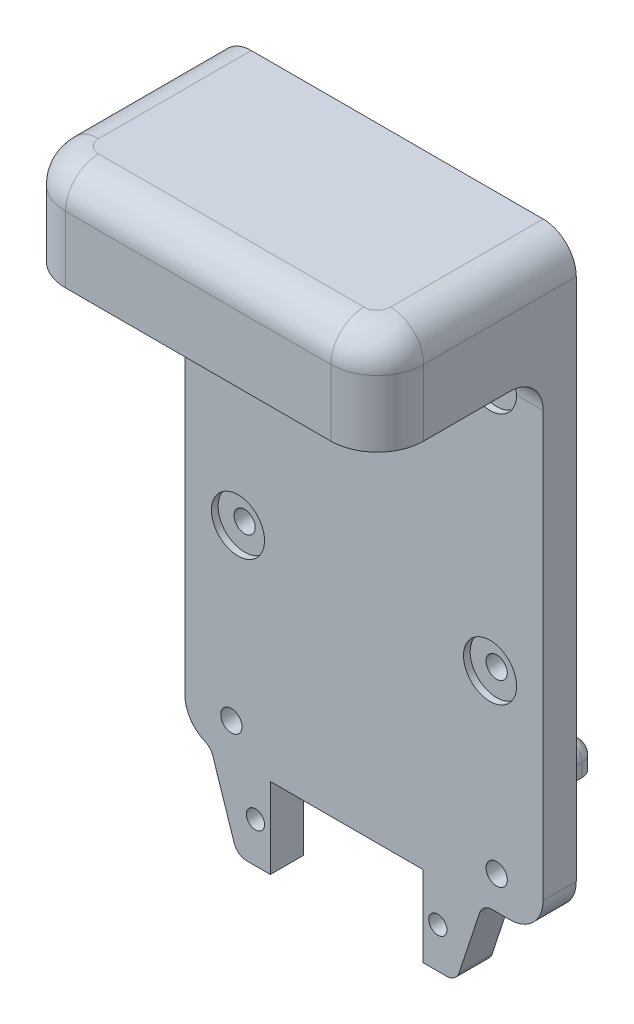
from build123d import *

# Parameters (mm, degrees)
SKETCH_1_R               = 1.6
SKETCH_1_R_2             = 1.375
EXTRUDE_1_DEPTH          = 5
SKETCH_2_W               = 54
SKETCH_2_H               = 15
EXTRUDE_2_DEPTH          = 25
SKETCH_3_R               = 3
CUT_EXTRUDE_1_DEPTH      = 10
FILLET_1_R               = 7
FILLET_2_R               = 5
FILLET_3_R               = 5
CHAMFER_1_SIZE           = 0.5
CUT_EXTRUDE_2_DEPTH      = 73.226189886
CUT_EXTRUDE_2_DEPTH_BACK = 1
SKETCH_4_R               = 4
FILLET_4_R               = 5
SKETCH_5_W               = 23
SKETCH_5_H               = 4
EXTRUDE_3_DEPTH          = 21
FILLET_5_R               = 2
FILLET_6_R               = 3
CUT_EXTRUDE_3_DEPTH      = 1
CUT_EXTRUDE_3_DEPTH_BACK = 75.10548229
SKETCH_6_R               = 3.25


with BuildPart() as part:
    # 草图1 → 凸台-拉伸1 (new body)
    with BuildSketch(Plane.XY):
        Polygon((-27, -50), (-23.12, -50), (-19.12, -62.15), (-14.12, -62.15), (-14.12, -50), (8.88, -50), (8.88, -62.15), (13.88, -62.15), (17.88, -50), (27, -50), (27, 39), (-27, 39), align=None)
        with Locations((-19, 19)):
            Circle(SKETCH_1_R, mode=Mode.SUBTRACT)
        with Locations((19, 19)):
            Circle(SKETCH_1_R, mode=Mode.SUBTRACT)
        with Locations((19, -19)):
            Circle(SKETCH_1_R, mode=Mode.SUBTRACT)
        with Locations((-19, -19)):
            Circle(SKETCH_1_R, mode=Mode.SUBTRACT)
        with Locations((-20, -45)):
            Circle(SKETCH_1_R, mode=Mode.SUBTRACT)
        with Locations(Location((20, -45, 0), (0, 0, 180))):
            Circle(SKETCH_1_R, mode=Mode.SUBTRACT)
        with Locations((-16.37, -56.075)):
            Circle(SKETCH_1_R_2, mode=Mode.SUBTRACT)
        with Locations(Location((11.13, -56.075, 0), (0, 0, 180))):
            Circle(SKETCH_1_R_2, mode=Mode.SUBTRACT)
    extrude(amount=EXTRUDE_1_DEPTH)

    # 草图2 → 凸台-拉伸2 (add)
    with BuildSketch(Plane.XY.offset(5)):
        with Locations((0, 31.5)):
            Rectangle(SKETCH_2_W, SKETCH_2_H)
    extrude(amount=EXTRUDE_2_DEPTH)

    # 草图3 → 切除-拉伸1 (cut)
    with BuildSketch(Plane.XZ.offset(-24)):
        with Locations(Location((-20, 23, 0), (0, 0, 270))):
            Circle(SKETCH_3_R)
        with Locations(Location((20, 23, 0), (0, 0, 90))):
            Circle(SKETCH_3_R)
    extrude(amount=-CUT_EXTRUDE_1_DEPTH, mode=Mode.SUBTRACT)

    # 圆角1
    fillet_1_edges = [part.edges().sort_by_distance(p)[0] for p in [
        (-27, 31.5, 30),
        (27, 31.5, 30),
    ]]
    fillet(fillet_1_edges, radius=FILLET_1_R)

    # 圆角2
    fillet_2_edges = [part.edges().sort_by_distance(p)[0] for p in [
        (0, 39, 30),
        (-27, 39, 11.5),
        (27, 39, 11.5),
        (-24.949747468, 39, 27.949747468),
        (24.949747468, 39, 27.949747468),
    ]]
    fillet(fillet_2_edges, radius=FILLET_2_R)

    # 圆角3
    # the kernel refuses this fillet: 5 mm, written as the material it adds along each edge
    with BuildSketch(Plane(origin=(27, 24, 5), x_dir=(0, 0, 1), z_dir=(-1, 0, 0))) as fillet_3_piece_1_section:
        with BuildLine():
            CenterArc((FILLET_3_R, -FILLET_3_R), FILLET_3_R, 90, 90)
            Line((0, -FILLET_3_R), (0, 0))
            Line((0, 0), (FILLET_3_R, 0))
        make_face()
    fillet_3_piece_1 = extrude(amount=54, mode=Mode.PRIVATE)
    fillet_3_piece_1 = fillet_3_piece_1 - Plane(origin=(-19, 19, 6.136368117), x_dir=(1, 0, 0), z_dir=(0, 0, -1)) * Cylinder(1.6, 128, mode=Mode.PRIVATE)
    fillet_3_piece_1 = fillet_3_piece_1 - Plane(origin=(19, 19, 6.136368117), x_dir=(1, 0, 0), z_dir=(0, 0, -1)) * Cylinder(1.6, 128, mode=Mode.PRIVATE)
    add(fillet_3_piece_1)

    # 倒角1
    chamfer_1_edges = [part.edges().sort_by_distance(p)[0] for p in [
        (-20, 24, 26),
        (20, 24, 20),
    ]]
    chamfer(chamfer_1_edges, length=CHAMFER_1_SIZE)

    # 草图4 → 切除-拉伸2 (cut, two sides: drawn at the far end of the back side and taken through both)
    with BuildSketch(Plane.XY.offset(5).offset(-CUT_EXTRUDE_2_DEPTH_BACK)):
        with Locations((-19, 19)):
            Circle(SKETCH_4_R)
        with Locations((19, 19)):
            Circle(SKETCH_4_R)
        with Locations(Location((-19, -19, 0), (0, 0, 180))):
            Circle(SKETCH_4_R)
        with Locations(Location((19, -19, 0), (0, 0, 180))):
            Circle(SKETCH_4_R)
    extrude(amount=CUT_EXTRUDE_2_DEPTH + CUT_EXTRUDE_2_DEPTH_BACK, mode=Mode.SUBTRACT)

    # 圆角4
    # the kernel refuses this fillet: 5 mm, written as the material it takes off along each edge
    with BuildSketch(Plane(origin=(27, -50, -12.5), x_dir=(0, 1, 0), z_dir=(0, 0, 1))) as fillet_4_piece_1:
        with BuildLine():
            CenterArc((FILLET_4_R, FILLET_4_R), FILLET_4_R, 180, 90)
            Line((0, FILLET_4_R), (-FILLET_4_R * 0.02, FILLET_4_R))
            Line((-FILLET_4_R * 0.02, FILLET_4_R), (-FILLET_4_R * 0.02, -FILLET_4_R * 0.02))
            Line((-FILLET_4_R * 0.02, -FILLET_4_R * 0.02), (FILLET_4_R, -FILLET_4_R * 0.02))
            Line((FILLET_4_R, -FILLET_4_R * 0.02), (FILLET_4_R, 0))
        make_face()
    extrude(amount=30, mode=Mode.SUBTRACT)
    with BuildSketch(Plane(origin=(-27, -50, -12.182364303), x_dir=(0, 1, 0), z_dir=(0, 0, 1))) as fillet_4_piece_2:
        with BuildLine():
            CenterArc((4.872945721, -5), FILLET_4_R, 90, 77.055918457)
            Line((0, -3.88), (-0.097458914, -3.8576))
            ThreePointArc((-0.097458914, -3.8576), (-0.1, -1.94), (-0.1, 0))
            Line((-0.1, 0), (0, 0.1))
            Line((0, 0.1), (4.872945721, 0.1))
            Line((4.872945721, 0.1), (4.872945721, 0))
        make_face()
    extrude(amount=29.364728605, mode=Mode.SUBTRACT)

    # 草图5 → 凸台-拉伸3 (add)
    with BuildSketch(Plane(origin=(0, 0, 0), x_dir=(-1, 0, 0), z_dir=(0, 0, -1))):
        with Locations((2.62, -48)):
            Rectangle(SKETCH_5_W, SKETCH_5_H)
    extrude(amount=EXTRUDE_3_DEPTH)

    # 圆角5
    fillet_5_edges = [part.edges().sort_by_distance(p)[0] for p in [
        (8.88, -46, -10.5),
        (-14.12, -46, -10.5),
        (8.88, -48, -21),
        (-14.12, -48, -21),
        (-2.62, -46, -21),
        (17.88, -50, 2.5),
        (13.88, -62.15, 2.5),
        (-19.12, -62.15, 2.5),
        (-23.12, -50, 2.5),
    ]]
    fillet(fillet_5_edges, radius=FILLET_5_R)

    # 圆角6
    fillet_6_edges = [part.edges().sort_by_distance(p)[0] for p in [
        (-14.12, -49, 0),
        (8.88, -49, 0),
        (-2.62, -46, 0),
        (8.294213562, -46.585786438, 0),
        (-13.534213562, -46.585786438, 0),
    ]]
    fillet(fillet_6_edges, radius=FILLET_6_R)

    # 草图6 → 切除-拉伸3 (cut, two sides: drawn at the far end of the back side and taken through both)
    with BuildSketch(Plane.XY.offset(-CUT_EXTRUDE_3_DEPTH_BACK)):
        with Locations((-20, -45)):
            Circle(SKETCH_6_R)
        with Locations((20, -45)):
            Circle(SKETCH_6_R)
    extrude(amount=CUT_EXTRUDE_3_DEPTH + CUT_EXTRUDE_3_DEPTH_BACK, mode=Mode.SUBTRACT)


solid = part.part
